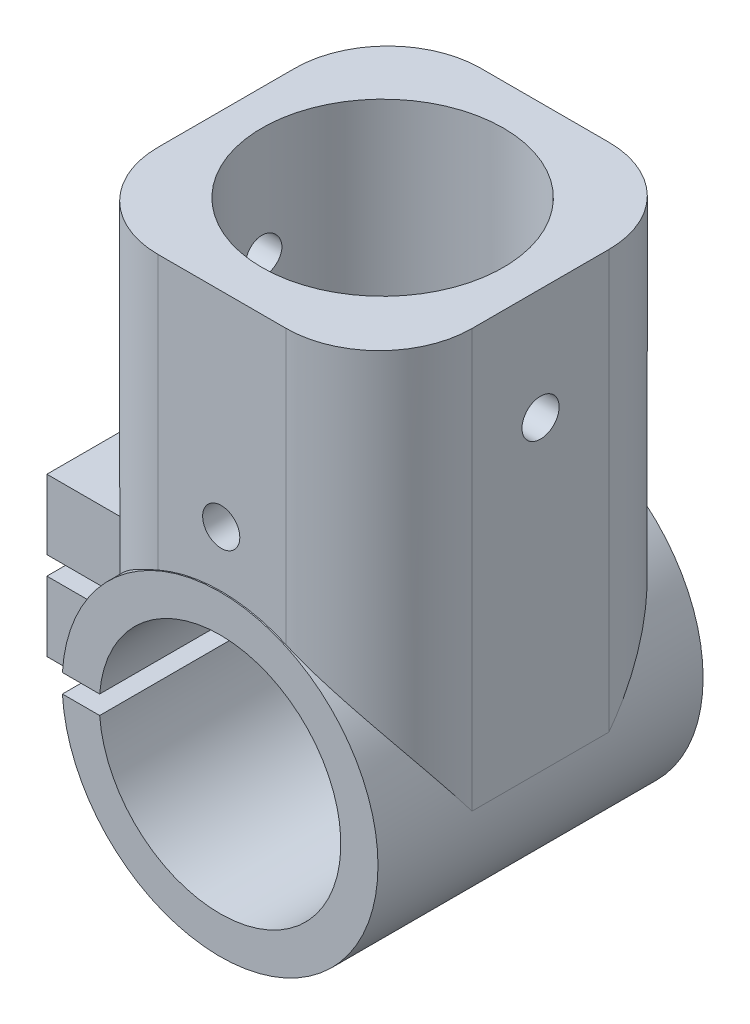
from build123d import *
from build123d.topology import SkipClean

# Parameters (mm, degrees)
SKETCH_1_R                            = 17
SKETCH_1_R_2                          = 12
EXTRUDE_2_DEPTH                       = 35
SKETCH_3_W                            = 33.795275063
SKETCH_3_H                            = 34.72803434
SKETCH_3_R                            = 13
EXTRUDE_7_DEPTH                       = 45
SKETCH_4_R                            = 13
CUT_EXTRUDE_1_DEPTH                   = 60.489495005
SKETCH_12_R                           = 2
CUT_EXTRUDE_11_DEPTH                  = 45
SKETCH_15_R                           = 2
CUT_EXTRUDE_12_DEPTH                  = 45
FILLET_4_R                            = 10
SKETCH_20_R                           = 13
CUT_EXTRUDE_18_DEPTH                  = 31
EXTRUDE_START                         = 1
SKETCH_25_R                           = 13
EXTRUDE_10_DEPTH                      = 1
CUT_EXTRUDE_19_REACH                  = 68.273
CUT_EXTRUDE_19_END_RADIUS             = 13
SKETCH_26_W                           = 35
SKETCH_26_H                           = 2
CUT_EXTRUDE_19_DIRECTION_2_REACH      = 68.273
CUT_EXTRUDE_19_DIRECTION_2_END_RADIUS = 17
EXTRUDE_11_DEPTH                      = 12
EXTRUDE_11_DEPTH_BACK                 = 3
SKETCH_27_W                           = 14.7
SKETCH_27_H                           = 7.5
EXTRUDE_12_DEPTH                      = 5
SKETCH_30_R                           = 1.6
CUT_EXTRUDE_21_DEPTH                  = 5
CUT_EXTRUDE_22_DEPTH                  = 3.2
SKETCH_34_R                           = 2
CUT_EXTRUDE_23_DEPTH                  = 59.192936687


with BuildPart() as part:
    # Эскиз1 → Бобышка-Вытянуть2 (new body)
    with BuildSketch(Plane.XY):
        Circle(SKETCH_1_R)
        Circle(SKETCH_1_R_2, mode=Mode.SUBTRACT)
    extrude(amount=EXTRUDE_2_DEPTH)

    # Эскиз3 → Бобышка-Вытянуть7 (add)
    with BuildSketch(Plane(origin=(0, 45, 0), x_dir=(1, 0, 0), z_dir=(0, 1, 0))):
        with Locations((0.102362468, -17.511098906)):
            Rectangle(SKETCH_3_W, SKETCH_3_H)
        with Locations(Location((0, -17.5, 0), (0, 0, 270))):
            Circle(SKETCH_3_R, mode=Mode.SUBTRACT)
    extrude(amount=-EXTRUDE_7_DEPTH)

    # Эскиз4 → Вырез-Вытянуть1 (cut, through all)
    with BuildSketch(Plane(origin=(0, 0, 0), x_dir=(-1, 0, 0), z_dir=(0, 0, -1))):
        Circle(SKETCH_4_R)
    extrude(amount=-CUT_EXTRUDE_1_DEPTH, mode=Mode.SUBTRACT)

    # Эскиз12 → Вырез-Вытянуть11 (cut)
    with BuildSketch(Plane(origin=(0, 0, 0), x_dir=(-1, 0, 0), z_dir=(0, 0, -1))):
        with Locations((0, 23)):
            Circle(SKETCH_12_R)
    extrude(amount=-CUT_EXTRUDE_11_DEPTH, mode=Mode.SUBTRACT)

    # Эскиз15 → Вырез-Вытянуть12 (cut)
    with BuildSketch(Plane.ZY.offset(16.795275063)):
        with Locations((17.5, 33)):
            Circle(SKETCH_15_R)
    extrude(amount=-CUT_EXTRUDE_12_DEPTH, mode=Mode.SUBTRACT)

    # Скругление4
    # the kernel refuses this fillet: 10 mm, written as the material it takes off along each edge
    with BuildSketch(Plane(origin=(-16.795275063, 70, 34.875116076), x_dir=(1, 0, 0), z_dir=(0, -1, 0))) as fillet_4_piece_1_section:
        with BuildLine():
            CenterArc((FILLET_4_R, -FILLET_4_R), FILLET_4_R, 90, 90)
            Line((0, -FILLET_4_R), (0, 0))
            Line((0, 0), (FILLET_4_R, 0))
        make_face()
    fillet_4_piece_1 = extrude(amount=92.369651061, mode=Mode.PRIVATE)
    fillet_4_piece_1 = fillet_4_piece_1 - Plane(origin=(0, 0, 32.54483178), x_dir=(1, 0, 0), z_dir=(0, 0, -1)) * Cylinder(17, 225, mode=Mode.PRIVATE)
    add(fillet_4_piece_1, mode=Mode.SUBTRACT)
    with BuildSketch(Plane(origin=(17, 70, 0.147081736), x_dir=(0, 0, 1), z_dir=(0, -1, 0))) as fillet_4_piece_2_section:
        with BuildLine():
            CenterArc((FILLET_4_R, FILLET_4_R), FILLET_4_R, 180, 90)
            Line((0, FILLET_4_R), (0, 0))
            Line((0, 0), (FILLET_4_R, 0))
        make_face()
    fillet_4_piece_2 = extrude(amount=95, mode=Mode.PRIVATE)
    fillet_4_piece_2 = fillet_4_piece_2 - Plane(origin=(0, 0, 2.486350956), x_dir=(1, 0, 0), z_dir=(0, 0, -1)) * Cylinder(17, 230, mode=Mode.PRIVATE)
    add(fillet_4_piece_2, mode=Mode.SUBTRACT)
    with BuildSketch(Plane(origin=(17, 70, 34.875116076), x_dir=(0, 0, -1), z_dir=(0, -1, 0))) as fillet_4_piece_3_section:
        with BuildLine():
            CenterArc((FILLET_4_R, -FILLET_4_R), FILLET_4_R, 90, 90)
            Line((0, -FILLET_4_R), (0, 0))
            Line((0, 0), (FILLET_4_R, 0))
        make_face()
    fillet_4_piece_3 = extrude(amount=95, mode=Mode.PRIVATE)
    fillet_4_piece_3 = fillet_4_piece_3 - Plane(origin=(0, 0, 32.535846855), x_dir=(1, 0, 0), z_dir=(0, 0, -1)) * Cylinder(17, 230, mode=Mode.PRIVATE)
    add(fillet_4_piece_3, mode=Mode.SUBTRACT)
    with BuildSketch(Plane(origin=(-16.795275063, 70, 0.147081736), x_dir=(0, 0, 1), z_dir=(0, -1, 0))) as fillet_4_piece_4_section:
        with BuildLine():
            CenterArc((FILLET_4_R, -FILLET_4_R), FILLET_4_R, 90, 90)
            Line((0, -FILLET_4_R), (0, 0))
            Line((0, 0), (FILLET_4_R, 0))
        make_face()
    fillet_4_piece_4 = extrude(amount=92.369651061, mode=Mode.PRIVATE)
    fillet_4_piece_4 = fillet_4_piece_4 - Plane(origin=(0, 0, 2.477367304), x_dir=(1, 0, 0), z_dir=(0, 0, -1)) * Cylinder(17, 225, mode=Mode.PRIVATE)
    add(fillet_4_piece_4, mode=Mode.SUBTRACT)

    # Эскиз20 → Вырез-Вытянуть18 (cut)
    with SkipClean():  # the faces are left unmerged after this step: merging them gives an invalid solid
        with BuildSketch(Plane(origin=(0, 45, 0), x_dir=(1, 0, 0), z_dir=(0, 1, 0))):
            with Locations(Location((0, -17.5, 0), (0, 0, 270))):
                Circle(SKETCH_20_R)
        extrude(amount=-CUT_EXTRUDE_18_DEPTH, mode=Mode.SUBTRACT)

    # Эскиз25 → Бобышка-Вытянуть10 (add)
    with BuildSketch(Plane(origin=(0, 14, 0), x_dir=(1, 0, 0), z_dir=(0, 1, 0)).offset(EXTRUDE_START)):
        with Locations(Location((0, -17.5, 0), (0, 0, 270))):
            Circle(SKETCH_25_R)
    extrude(amount=-EXTRUDE_10_DEPTH)

    # Вырез-Вытянуть19: up to this cylinder (the profile starts outside it)
    cut_extrude_19_end = Plane(origin=(0, 0, 17.5), z_dir=(0, 0, -1)) * Cylinder(CUT_EXTRUDE_19_END_RADIUS, 163.546, mode=Mode.PRIVATE)
    # Эскиз26 → Вырез-Вытянуть19 (cut, up to the surface)
    with BuildSketch(Plane.ZY.offset(16.795275063), mode=Mode.PRIVATE) as cut_extrude_19_sk1:
        with Locations((17.5, 0)):
            Rectangle(SKETCH_26_W, SKETCH_26_H)
    cut_extrude_19_tool1 = extrude(cut_extrude_19_sk1.sketch, amount=-CUT_EXTRUDE_19_REACH, mode=Mode.PRIVATE) - cut_extrude_19_end
    add(cut_extrude_19_tool1.solids().sort_by_distance((-16.795275, 0, 17.5))[0], mode=Mode.SUBTRACT)

    # Вырез-Вытянуть19 direction 2: up to this cylinder (the profile starts inside it)
    cut_extrude_19_direction_2_end = Plane(origin=(0, 0, 17.5), z_dir=(0, 0, -1)) * Cylinder(CUT_EXTRUDE_19_DIRECTION_2_END_RADIUS, 171.546, mode=Mode.PRIVATE)
    # Эскиз26 → Вырез-Вытянуть19 direction 2 (cut, up to the surface)
    with BuildSketch(Plane.ZY.offset(16.795275063), mode=Mode.PRIVATE) as cut_extrude_19_direction_2_sk1:
        with Locations((17.5, 0)):
            Rectangle(SKETCH_26_W, SKETCH_26_H)
    cut_extrude_19_direction_2_tool1 = extrude(cut_extrude_19_direction_2_sk1.sketch, amount=CUT_EXTRUDE_19_DIRECTION_2_REACH, mode=Mode.PRIVATE) & cut_extrude_19_direction_2_end
    add(cut_extrude_19_direction_2_tool1.solids().sort_by_distance((-16.795275, 0, 17.5))[0], mode=Mode.SUBTRACT)

    # Эскиз27 → Бобышка-Вытянуть11 (add, two sides: drawn at the far end of the back side and taken through both)
    with BuildSketch(Plane.ZY.offset(16.795275063).offset(-EXTRUDE_11_DEPTH_BACK)):
        with Locations((17.497081736, 4.75)):
            Rectangle(SKETCH_27_W, SKETCH_27_H)
        with Locations((17.497081736, -4.75)):
            Rectangle(SKETCH_27_W, SKETCH_27_H)
    extrude(amount=EXTRUDE_11_DEPTH + EXTRUDE_11_DEPTH_BACK)

    # Эскиз29 → Бобышка-Вытянуть12 (add)
    with BuildSketch(Plane(origin=(0, 0, 0), x_dir=(-1, 0, 0), z_dir=(0, 0, -1))):
        with BuildLine():
            Line((3.04805277, -12.647504667), (3.04805277, -3.334582187))
            ThreePointArc((3.04805277, -3.334582187), (-4.517749888, 0), (3.04805277, 3.334582187))
            Line((3.04805277, 3.334582187), (3.04805277, 12.647504667))
            ThreePointArc((3.04805277, 12.647504667), (-13.009611831, 0), (3.04805277, -12.647504667))
        make_face()
    extrude(amount=-EXTRUDE_12_DEPTH)

    # Эскиз30 → Вырез-Вытянуть21 (cut)
    with BuildSketch(Plane(origin=(0, 0, 0), x_dir=(-1, 0, 0), z_dir=(0, 0, -1))):
        with Locations((-0.517749888, -8.75)):
            Circle(SKETCH_30_R)
        with Locations((-0.517749888, 8.75)):
            Circle(SKETCH_30_R)
    extrude(amount=-CUT_EXTRUDE_21_DEPTH, mode=Mode.SUBTRACT)

    # Эскиз28 → Вырез-Вытянуть22 (cut)
    with BuildSketch(Plane(origin=(0, 8.5, 0), x_dir=(1, 0, 0), z_dir=(0, 1, 0))):
        Polygon((-25.595275063, -17.497081736), (-24.195275063, -19.921952866), (-21.395275063, -19.921952866), (-19.995275063, -17.497081736), (-21.395275063, -15.072210605), (-24.195275063, -15.072210605), align=None)
    extrude(amount=-CUT_EXTRUDE_22_DEPTH, mode=Mode.SUBTRACT)

    # Эскиз34 → Вырез-Вытянуть23 (cut, through all)
    with BuildSketch(Plane(origin=(0, 8.5, 0), x_dir=(1, 0, 0), z_dir=(0, 1, 0))):
        with Locations(Location((-22.795275063, -17.497081736, 0), (0, 0, 270))):
            Circle(SKETCH_34_R)
    extrude(amount=-CUT_EXTRUDE_23_DEPTH, mode=Mode.SUBTRACT)


solid = part.part
